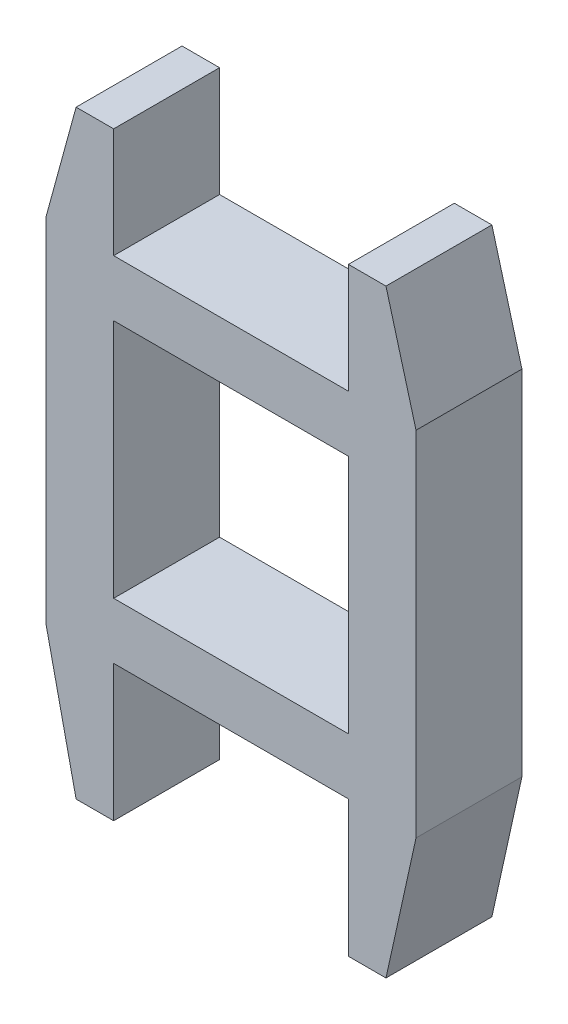
from build123d import *

# Parameters (mm, degrees)
SKETCH1_W           = 12.5
SKETCH1_H           = 12.8
BOSS_EXTRUDE1_DEPTH = 5.64


with BuildPart() as part:
    # Sketch1 → Boss-Extrude1 (new body)
    with BuildSketch(Plane.XY):
        Polygon((1245.159623553, 971.126361431), (1247.159623553, 971.126361431), (1247.159623553, 965.277195661), (1259.659623553, 965.277195661), (1259.659623553, 971.126361431), (1261.659623553, 971.126361431), (1263.259623553, 965.277195661), (1263.259623553, 946.477195661), (1261.659623553, 939.218029888), (1259.659623553, 939.218029888), (1259.659623553, 946.477195661), (1247.159623553, 946.477195661), (1247.159623553, 939.218029888), (1245.159623553, 939.218029888), (1243.559623553, 946.477195661), (1243.559623553, 965.277195661), align=None)
        with Locations((1253.409623553, 955.877195661)):
            Rectangle(SKETCH1_W, SKETCH1_H, mode=Mode.SUBTRACT)
    extrude(amount=BOSS_EXTRUDE1_DEPTH)


solid = part.part
